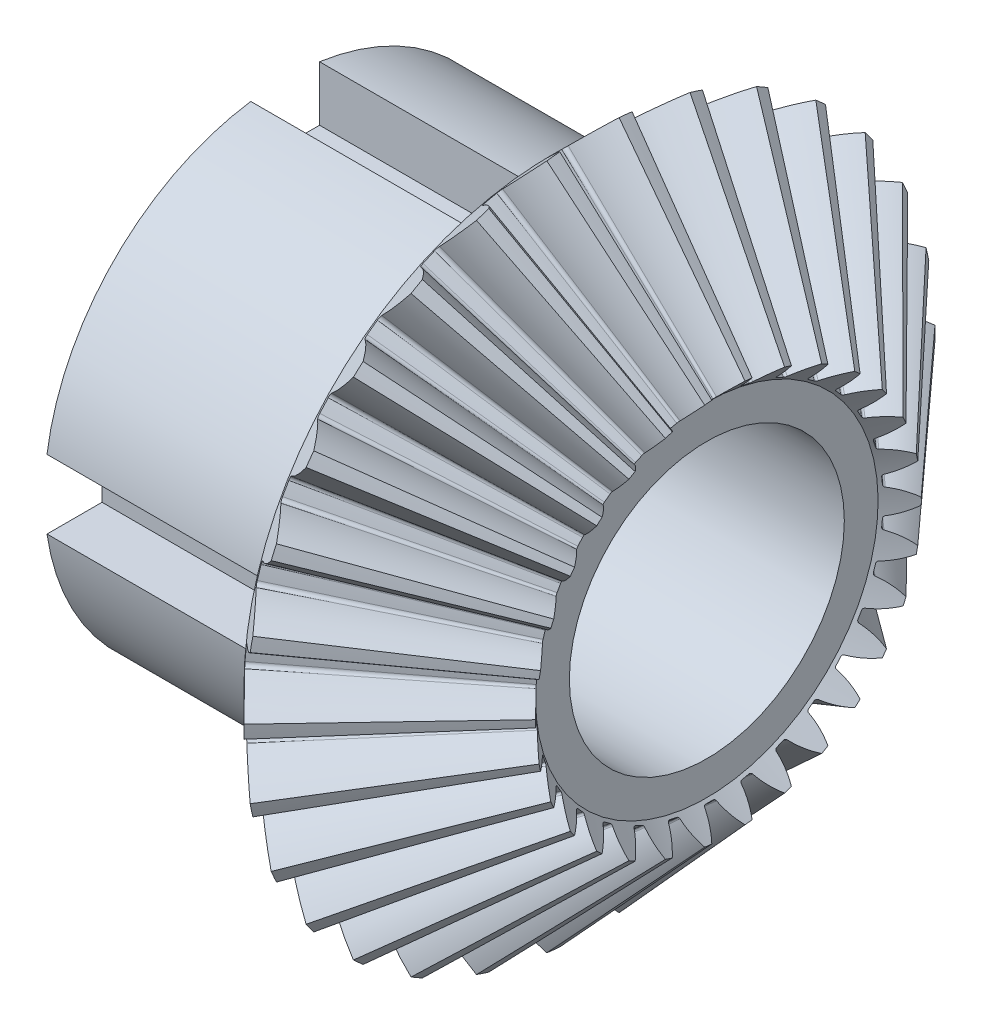
from build123d import *

# Parameters (mm, degrees)
TEETHCUTS_COUNT    = 30
TEETHCUTS_ANGLE    = 348
HUBSKE_R           = 8.75
HUB_DEPTH          = 9.65917486
BORSKE_R           = 5
BORE_DEPTH         = 22.5000508
CUT_EXTRUDE1_START = -8
CUT_EXTRUDE1_DEPTH = 8
CUT_EXTRUDE3_START = -8
CUT_EXTRUDE3_DEPTH = 8


with BuildPart() as part:
    # BasProSke → Base-Revolve (revolve)
    with BuildSketch(Plane(origin=(0, 0, 0), x_dir=(1, 0, 0), z_dir=(0, 1, 0)), mode=Mode.PRIVATE) as base_revolve_sk:
        Polygon((0, 0), (0, 11.159073261), (1.406612166, 12.565685424), (6.459913019, 7.012384561), (5.67494148, 6.227413023), (5.67494148, 0), align=None)
    revolve(base_revolve_sk.sketch.rotate(Axis((-10, 0, 0), (1, 0, 0)), 180), axis=Axis((-10, 0, 0), (1, 0, 0)))

    # ToothCut: read off the stored shape, not the designer's step
    # ToothCut: loft between two sections, ruled curve by curve
    toothcut_from = [
        Edge.make_bspline([(12.847300231, 0.006373491, -0.008946896), (12.842944603, 0.002017862, -0.015152536), (12.836793561, -0.004133179, -0.014268034), (12.833410296, -0.007516444, -0.006949565)], [0, 0, 0, 0, 1, 1, 1, 1], 3, [1, 0.752714571, 0.752714571, 1]),
        Edge.make_bspline([(12.833410296, -0.007516444, 0.006949565), (12.836793561, -0.004133179, 0.014268034), (12.842944603, 0.002017862, 0.015152536), (12.847300231, 0.006373491, 0.008946896)], [0, 0, 0, 0, 1, 1, 1, 1], 3, [1, 0.752714571, 0.752714571, 1]),
        Edge.make_bspline([(12.833410296, -0.007516444, -0.006949565), (12.832979803, -0.007946937, -0.00601835), (12.832639033, -0.008287707, -0.005015575), (12.832393827, -0.008532913, -0.003958429)], [0, 0, 0, 0, 1, 1, 1, 1], 3, [1, 0.994285284, 0.994285284, 1]),
        Edge.make_bspline([(12.832393827, -0.008532913, 0.003958429), (12.832639033, -0.008287707, 0.005015575), (12.832979803, -0.007946937, 0.00601835), (12.833410296, -0.007516444, 0.006949565)], [0, 0, 0, 0, 1, 1, 1, 1], 3, [1, 0.994285284, 0.994285284, 1]),
        Edge.make_bspline([(12.832393827, -0.008532913, -0.003958429), (12.831792233, -0.009134507, -0.001364802), (12.831792233, -0.009134507, 0.001364802), (12.832393827, -0.008532913, 0.003958429)], [0, 0, 0, 0, 1, 1, 1, 1], 3, [1, 0.966789815, 0.966789815, 1]),
        Edge.make_line((12.847300231, 0.006373491, 0.008946896), (12.847300231, 0.006373491, -0.008946896)),
    ]
    toothcut_to = [
        Edge.make_bspline([(1.545657618, 12.704730877, -1.243577752), (1.160511909, 12.319585168, -0.826758059), (0.721824165, 11.880897425, -0.534321367), (0.249368946, 11.408442207, -0.379449733)], [0, 0, 0, 0, 1, 1, 1, 1], 3, [1, 0.984974462, 0.984974462, 1]),
        Edge.make_bspline([(0.249368946, 11.408442207, 0.379449733), (0.721824165, 11.880897425, 0.534321367), (1.160511909, 12.319585168, 0.826758059), (1.545657618, 12.704730877, 1.243577752)], [0, 0, 0, 0, 1, 1, 1, 1], 3, [1, 0.984974462, 0.984974462, 1]),
        Edge.make_bspline([(0.249368946, 11.408442207, -0.379449733), (0.197873168, 11.356946428, -0.362569328), (0.165414848, 11.324488109, -0.303565147), (0.166509638, 11.325582899, -0.228824386)], [0, 0, 0, 0, 1, 1, 1, 1], 3, [1, 0.850930354, 0.850930354, 1]),
        Edge.make_bspline([(0.166509638, 11.325582899, 0.228824386), (0.165414848, 11.324488109, 0.303565147), (0.197873168, 11.356946428, 0.362569328), (0.249368946, 11.408442207, 0.379449733)], [0, 0, 0, 0, 1, 1, 1, 1], 3, [1, 0.850930354, 0.850930354, 1]),
        Edge.make_bspline([(0.166509638, 11.325582899, -0.228824386), (0.168743998, 11.327817259, -0.076285704), (0.168743998, 11.327817259, 0.076285704), (0.166509638, 11.325582899, 0.228824386)], [0, 0, 0, 0, 1, 1, 1, 1], 3, [1, 0.999857007, 0.999857007, 1]),
        Edge.make_line((1.545657618, 12.704730877, 1.243577752), (1.545657618, 12.704730877, -1.243577752)),
    ]
    toothcut = Solid(Shell([*[Face.make_surface_from_curves(toothcut_from[k], toothcut_to[k]) for k in range(6)], Face(Wire(toothcut_from)), Face(Wire(toothcut_to))]))
    add(toothcut, mode=Mode.SUBTRACT)

    # TeethCuts: ToothCut ×30 about axis
    teethcuts_axis = Axis((-10, 0, 0), (1, 0, 0))
    for i in range(1, TEETHCUTS_COUNT):
        add(toothcut.rotate(teethcuts_axis, i * TEETHCUTS_ANGLE / (TEETHCUTS_COUNT - 1)), mode=Mode.SUBTRACT)

    # HubSke → Hub (add)
    with BuildSketch(Plane.ZY):
        with Locations(Location((0, 0, 0), (0, 0, 180))):
            Circle(HUBSKE_R)
    extrude(amount=HUB_DEPTH)

    # BorSke → Bore (cut, symmetric)
    with BuildSketch(Plane(origin=(0, 0, 0), x_dir=(0, 0, -1), z_dir=(1, 0, 0))):
        with Locations(Location((0, 0, 0), (0, 0, 180))):
            Circle(BORSKE_R)
    extrude(amount=BORE_DEPTH, both=True, mode=Mode.SUBTRACT)

    # Sketch1 → Cut-Extrude1 (cut)
    with BuildSketch(Plane.ZY.offset(9.65917486).offset(CUT_EXTRUDE1_START)):
        with BuildLine():
            Line((-1.25, 8.660254038), (-1.25, 6.660254038))
            Line((-1.25, 6.660254038), (1.25, 6.660254038))
            Line((1.25, 6.660254038), (1.25, 8.660254038))
            ThreePointArc((1.25, 8.660254038), (0, 8.75), (-1.25, 8.660254038))
        make_face()
        with BuildLine():
            Line((-1.25, -6.660254038), (-1.25, -8.660254038))
            ThreePointArc((-1.25, -8.660254038), (0, -8.75), (1.25, -8.660254038))
            Line((1.25, -8.660254038), (1.25, -6.660254038))
            Line((1.25, -6.660254038), (-1.25, -6.660254038))
        make_face()
    extrude(amount=CUT_EXTRUDE1_DEPTH, mode=Mode.SUBTRACT)

    # Sketch2 → Cut-Extrude3 (cut)
    with BuildSketch(Plane.ZY.offset(9.65917486).offset(CUT_EXTRUDE3_START)):
        with BuildLine():
            ThreePointArc((-8.660254038, 1.25), (-8.749998919, -0.004349539), (-8.659007033, -1.258609236))
            Line((-8.659007033, -1.258609236), (-6.659007033, -1.258609236))
            Line((-6.659007033, -1.258609236), (-6.659007033, 1.25))
            Line((-6.659007033, 1.25), (-8.660254038, 1.25))
        make_face()
        with BuildLine():
            Line((6.660254038, -1.258609236), (8.659007033, -1.258609236))
            ThreePointArc((8.659007033, -1.258609236), (8.727222111, -0.630947092), (8.75, 0))
            ThreePointArc((8.75, 0), (8.72753467, 0.626608797), (8.660254038, 1.25))
            Line((8.660254038, 1.25), (6.660254038, 1.25))
            Line((6.660254038, 1.25), (6.660254038, -1.258609236))
        make_face()
    extrude(amount=CUT_EXTRUDE3_DEPTH, mode=Mode.SUBTRACT)


solid = part.part
